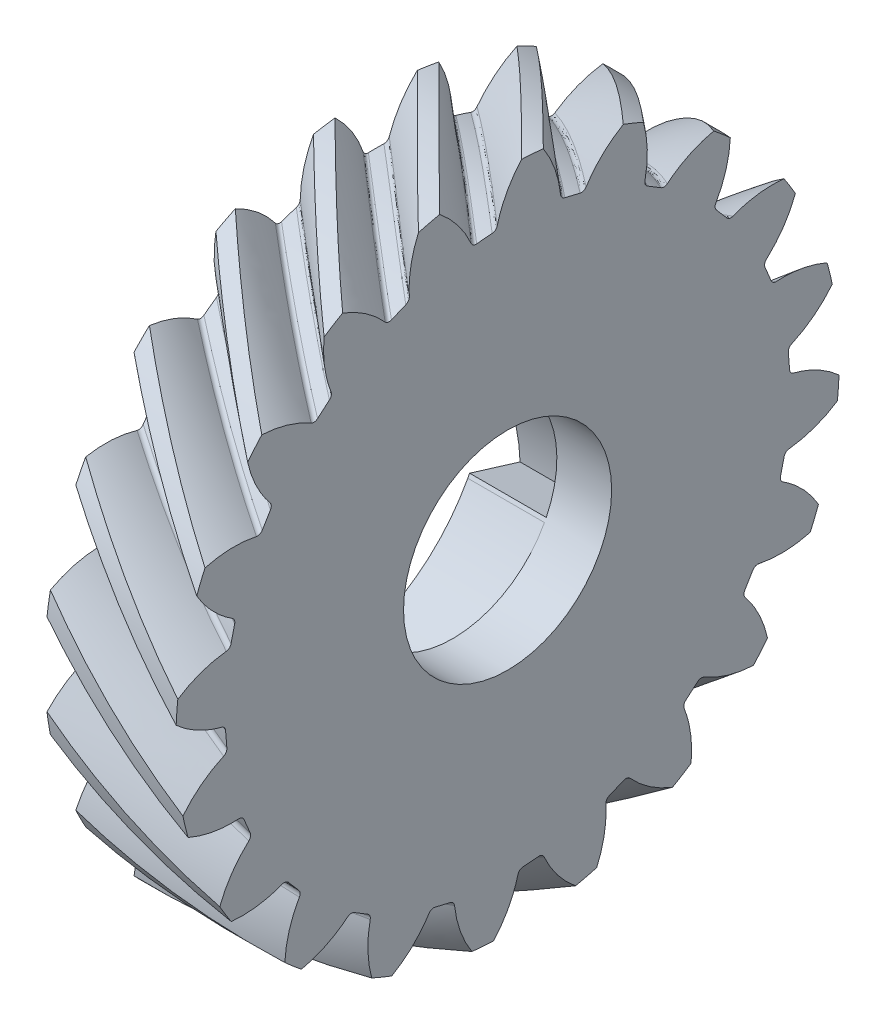
from build123d import *

# Parameters (mm, degrees)
BASPROSKE_W            = 12
BASPROSKE_H            = 30.284271247
TOOTHCUTRH_PITCH       = 190.281688141
TOOTHCUTRH_HEIGHT      = 12
TOOTHCUTRH_RADIUS      = 30.284271247
TOOTHCUTRH_START_ANGLE = -90
TEETHCUTSRH_COUNT      = 20
TEETHCUTSRH_ANGLE      = 342
BORSKE_R               = 9.5
BORE_DEPTH             = 62.5000025
CUT_EXTRUDE1_START     = -7
CUT_EXTRUDE1_DEPTH     = 7


with BuildPart() as part:
    # BasProSke → Base-Revolve (revolve)
    with BuildSketch(Plane(origin=(0, 0, 0), x_dir=(1, 0, 0), z_dir=(0, 1, 0)), mode=Mode.PRIVATE) as base_revolve_sk:
        with Locations((6, 15.142135624)):
            Rectangle(BASPROSKE_W, BASPROSKE_H)
    revolve(base_revolve_sk.sketch.rotate(Axis((-10, 0, 0), (1, 0, 0)), 180), axis=Axis((-10, 0, 0), (1, 0, 0)))

    # ToothCutRH: sweep along a helix
    with BuildLine() as toothcutrh_path:
        add(Helix(TOOTHCUTRH_PITCH, TOOTHCUTRH_HEIGHT, TOOTHCUTRH_RADIUS, center=(0, 0, 0), direction=(1, 0, 0), mode=Mode.PRIVATE).rotate(Axis((0, 0, 0), (1, 0, 0)), TOOTHCUTRH_START_ANGLE))
    # TooCutSkeRH → ToothCutRH (sweep, cut)
    with BuildSketch(Plane(origin=(0, 0, 0), x_dir=(0, 0, -1), z_dir=(1, 0, 0))):
        with BuildLine():
            ThreePointArc((0.709729235, 25.774501512), (0, 25.784271247), (-0.709729235, 25.774501512))
            ThreePointArc((-0.709729235, 25.774501512), (-1.007455511, 25.862538868), (-1.196142332, 26.109092706))
            ThreePointArc((-1.196142332, 26.109092706), (-2.588726145, 28.736284217), (-4.692249269, 30.837858717))
            ThreePointArc((-4.692249269, 30.837858717), (0, 31.192799385), (4.692249269, 30.837858717))
            ThreePointArc((4.692249269, 30.837858717), (2.588726145, 28.736284217), (1.196142332, 26.109092706))
            ThreePointArc((1.196142332, 26.109092706), (1.007455511, 25.862538868), (0.709729235, 25.774501512))
        make_face()
    toothcutrh = sweep(path=toothcutrh_path.line, is_frenet=True, mode=Mode.SUBTRACT)

    # TeethCutsRH: ToothCutRH ×20 about axis
    teethcutsrh_axis = Axis((-10, 0, 0), (1, 0, 0))
    for i in range(1, TEETHCUTSRH_COUNT):
        add(toothcutrh.rotate(teethcutsrh_axis, i * TEETHCUTSRH_ANGLE / (TEETHCUTSRH_COUNT - 1)), mode=Mode.SUBTRACT)

    # BorSke → Bore (cut, symmetric)
    with BuildSketch(Plane(origin=(0, 0, 0), x_dir=(0, 0, -1), z_dir=(1, 0, 0))):
        with Locations(Location((0, 0, 0), (0, 0, 180))):
            Circle(BORSKE_R)
    extrude(amount=BORE_DEPTH, both=True, mode=Mode.SUBTRACT)

    # Sketch3 → Cut-Extrude1 (cut)
    with BuildSketch(Plane.ZY.offset(CUT_EXTRUDE1_START)):
        with BuildLine():
            Line((5.594654178, -13.137540467), (4.182643639, -8.529683006))
            ThreePointArc((4.182643639, -8.529683006), (4.342487549, -8.449426128), (4.500792161, -8.366174151))
            ThreePointArc((4.500792161, -8.366174151), (10.688139752, -2.541984589), (13.137540467, 5.594654178))
            Line((13.137540467, 5.594654178), (8.529683006, 4.182643639))
            ThreePointArc((8.529683006, 4.182643639), (8.449426128, 4.342487549), (8.366174151, 4.500792161))
            ThreePointArc((8.366174151, 4.500792161), (2.541984589, 10.688139752), (-5.594654178, 13.137540467))
            Line((-5.594654178, 13.137540467), (-4.182643639, 8.529683006))
            ThreePointArc((-4.182643639, 8.529683006), (-4.342487549, 8.449426128), (-4.500792161, 8.366174151))
            ThreePointArc((-4.500792161, 8.366174151), (-10.688139752, 2.541984589), (-13.137540467, -5.594654178))
            Line((-13.137540467, -5.594654178), (-8.529683006, -4.182643639))
            ThreePointArc((-8.529683006, -4.182643639), (-8.449426128, -4.342487549), (-8.366174151, -4.500792161))
            ThreePointArc((-8.366174151, -4.500792161), (-2.541984589, -10.688139752), (5.594654178, -13.137540467))
        make_face()
    extrude(amount=CUT_EXTRUDE1_DEPTH, mode=Mode.SUBTRACT)


solid = part.part
